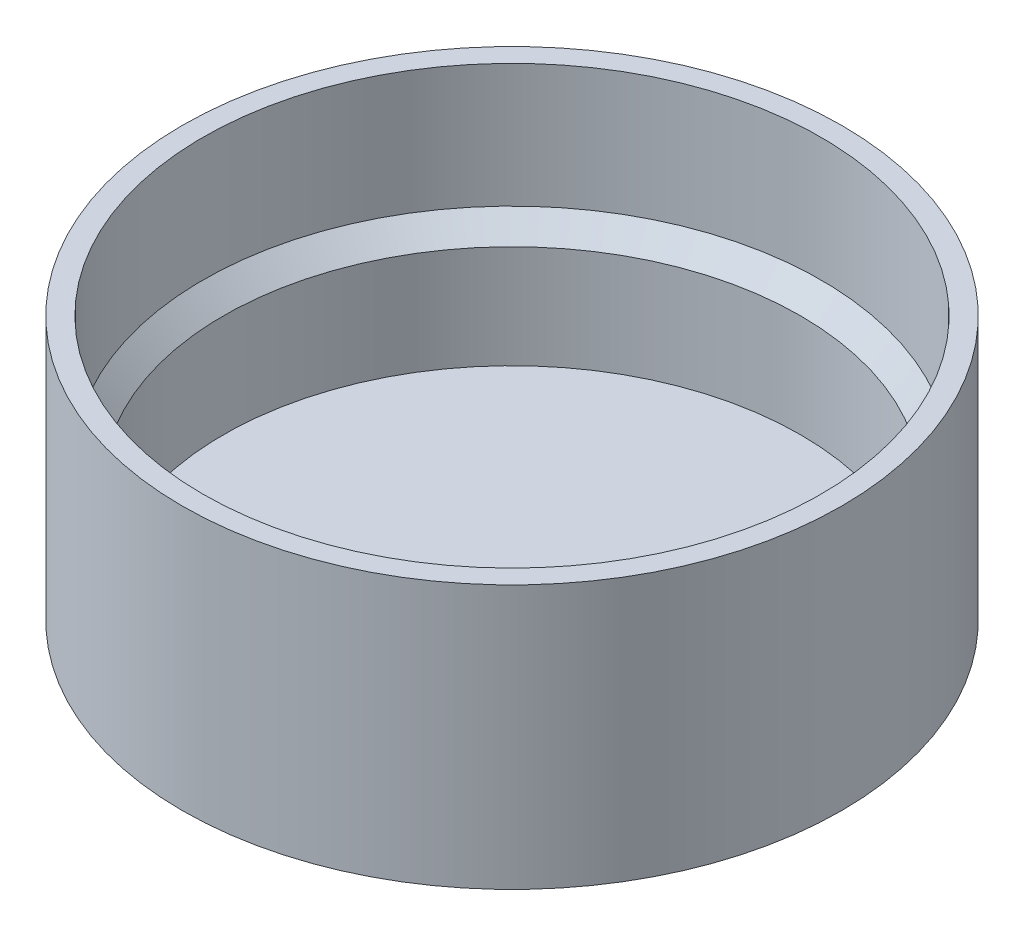
from build123d import *

# Parameters (mm, degrees)
CROQUIS1_R              = 40
SALIENTE_EXTRUIR1_DEPTH = 2
CROQUIS2_R              = 40
CROQUIS2_R_2            = 35
SALIENTE_EXTRUIR2_DEPTH = 30
CORTAR_EXTRUIR1_START   = -15
CROQUIS3_R              = 37.5
CROQUIS3_R_2            = 35
CORTAR_EXTRUIR1_DEPTH   = 15
CHAFL_N1_SIZE           = 2.5


with BuildPart() as part:
    # Croquis1 → Saliente-Extruir1 (new body)
    with BuildSketch(Plane(origin=(0, 0, 0), x_dir=(1, 0, 0), z_dir=(0, 1, 0))):
        with Locations(Location((0, 0, 0), (0, 0, 270))):
            Circle(CROQUIS1_R)
    extrude(amount=SALIENTE_EXTRUIR1_DEPTH)

    # Croquis2 → Saliente-Extruir2 (add)
    with BuildSketch(Plane(origin=(0, 2, 0), x_dir=(1, 0, 0), z_dir=(0, 1, 0))):
        with Locations(Location((0, 0, 0), (0, 0, 270))):
            Circle(CROQUIS2_R)
        with Locations(Location((0, 0, 0), (0, 0, 270))):
            Circle(CROQUIS2_R_2, mode=Mode.SUBTRACT)
    extrude(amount=SALIENTE_EXTRUIR2_DEPTH)

    # Croquis3 → Cortar-Extruir1 (cut)
    with BuildSketch(Plane(origin=(0, 32, 0), x_dir=(1, 0, 0), z_dir=(0, 1, 0)).offset(CORTAR_EXTRUIR1_START)):
        with Locations(Location((0, 0, 0), (0, 0, 270))):
            Circle(CROQUIS3_R)
        with Locations(Location((0, 0, 0), (0, 0, 270))):
            Circle(CROQUIS3_R_2, mode=Mode.SUBTRACT)
    extrude(amount=CORTAR_EXTRUIR1_DEPTH, mode=Mode.SUBTRACT)

    # Chaflán1
    chafl_n1_edges = [part.edges().sort_by_distance(p)[0] for p in [
        (0, 17, -35),
    ]]
    chamfer(chafl_n1_edges, length=CHAFL_N1_SIZE - 0.0001)  # a hair under: the kernel refuses the full size


solid = part.part
